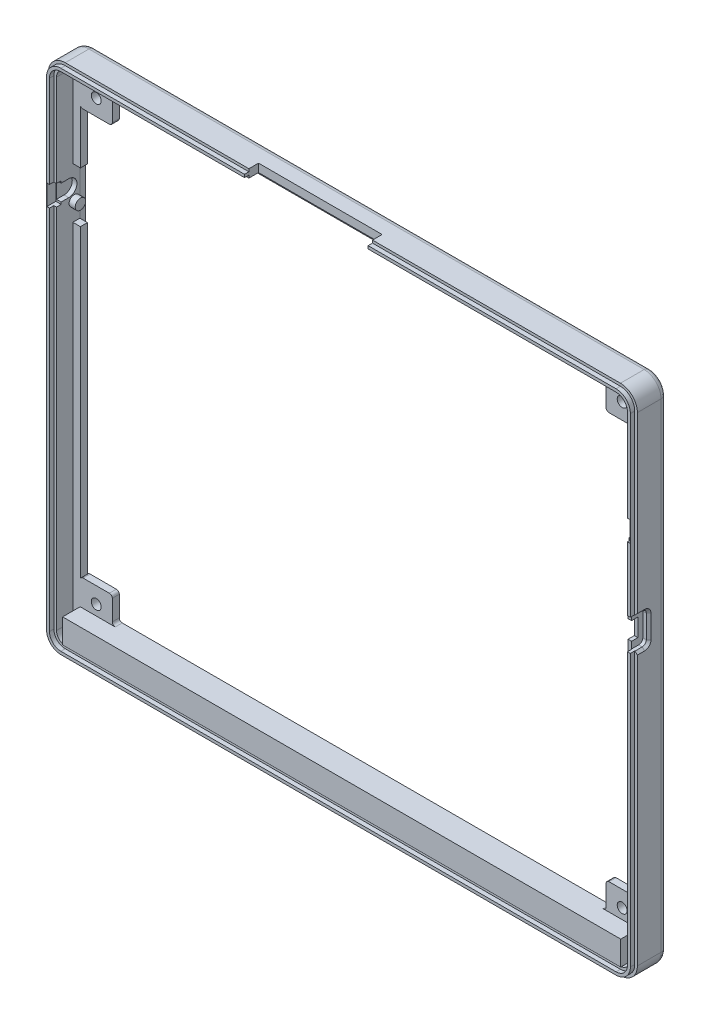
from build123d import *

# Parameters (mm, degrees)
PERIMETER_SHELL_START                = -7.6
PERIMETER_SHELL_DEPTH                = 5.6
OPEN_BACK_FRAME_START                = -12.1
OPEN_BACK_FRAME_DEPTH                = 4.5
PCB_MOUNT_WEB_0_START                = -12.1
PCB_MOUNT_WEB_0_DEPTH                = 4.5
PCB_M3_THROUGH_0_START               = -7.5
PCB_M3_THROUGH_0_PROFILE_R           = 1.7
PCB_M3_THROUGH_0_DEPTH               = 4.7
PCB_MOUNT_WEB_1_START                = -12.1
PCB_MOUNT_WEB_1_DEPTH                = 4.5
PCB_M3_THROUGH_1_START               = -7.5
PCB_M3_THROUGH_1_PROFILE_R           = 1.7
PCB_M3_THROUGH_1_DEPTH               = 4.7
PCB_MOUNT_WEB_2_START                = -12.1
PCB_MOUNT_WEB_2_DEPTH                = 4.5
PCB_M3_THROUGH_2_START               = -7.5
PCB_M3_THROUGH_2_PROFILE_R           = 1.7
PCB_M3_THROUGH_2_DEPTH               = 4.7
PCB_MOUNT_WEB_3_START                = -12.1
PCB_MOUNT_WEB_3_DEPTH                = 4.5
PCB_M3_THROUGH_3_START               = -7.5
PCB_M3_THROUGH_3_PROFILE_R           = 1.7
PCB_M3_THROUGH_3_DEPTH               = 4.7
REAR_GLASS_SEAT_START                = -10
REAR_GLASS_SEAT_DEPTH                = 2.2
PCB_LOWER_EDGE_WEB_START             = -10
PCB_LOWER_EDGE_WEB_PROFILE_W         = 191
PCB_LOWER_EDGE_WEB_PROFILE_H         = 8.3
PCB_LOWER_EDGE_WEB_DEPTH             = 8.4
PCB_SUPPORT_ROOT_ROUND_R             = 1
LOCATING_TONGUE_START                = -2
LOCATING_TONGUE_DEPTH                = 1.5
TOP_CONNECTOR_ACCESS_START           = 14.29999894
TOP_CONNECTOR_ACCESS_PROFILE_W       = 42.3
TOP_CONNECTOR_ACCESS_PROFILE_H       = 13.3
TOP_CONNECTOR_ACCESS_DEPTH           = 19.6
POWER_RETAINING_WEB_START            = -5.85
POWER_RETAINING_WEB_PROFILE_W        = 0.6
POWER_RETAINING_WEB_PROFILE_H        = 13.5
POWER_RETAINING_WEB_DEPTH            = 3.85
SLIDER_SLOT_START                    = -0.35
SLIDER_SLOT_PROFILE_W                = 7.8
SLIDER_SLOT_PROFILE_H                = 6.1
SLIDER_SLOT_DEPTH                    = 3.8
POWER_THUMB_RECESS_START             = 193.8
POWER_THUMB_RECESS_DEPTH             = 3.4
INTERNAL_HINGE_CLEARANCE_0_START     = -1.9
INTERNAL_HINGE_CLEARANCE_0_PROFILE_W = 7.2
INTERNAL_HINGE_CLEARANCE_0_PROFILE_H = 17.4
INTERNAL_HINGE_CLEARANCE_0_DEPTH     = 10.3
INTERNAL_STOP_PIN_0_START            = -3.5
INTERNAL_STOP_PIN_0_PROFILE_R        = 1.8
INTERNAL_STOP_PIN_0_DEPTH            = 2.6
BLIND_AXLE_BEARING_0_START           = -4.6
BLIND_AXLE_BEARING_0_PROFILE_R       = 2.8
BLIND_AXLE_BEARING_0_DEPTH           = 1.7
AXLE_ASSEMBLY_ENTRY_0_START          = -4.6
AXLE_ASSEMBLY_ENTRY_0_PROFILE_W      = 6.3
AXLE_ASSEMBLY_ENTRY_0_PROFILE_H      = 5.6
AXLE_ASSEMBLY_ENTRY_0_DEPTH          = 1.7
KEEPER_SEAT_0_START                  = 0.1
KEEPER_SEAT_0_PROFILE_W              = 2.1
KEEPER_SEAT_0_PROFILE_H              = 7
KEEPER_SEAT_0_DEPTH                  = 3.7
INTERNAL_HINGE_CLEARANCE_1_START     = -1.9
INTERNAL_HINGE_CLEARANCE_1_PROFILE_W = 7.2
INTERNAL_HINGE_CLEARANCE_1_PROFILE_H = 17.4
INTERNAL_HINGE_CLEARANCE_1_DEPTH     = 10.3
INTERNAL_STOP_PIN_1_START            = 190.9
INTERNAL_STOP_PIN_1_PROFILE_R        = 1.8
INTERNAL_STOP_PIN_1_DEPTH            = 2.6
BLIND_AXLE_BEARING_1_START           = 192.9
BLIND_AXLE_BEARING_1_PROFILE_R       = 2.8
BLIND_AXLE_BEARING_1_DEPTH           = 1.7
AXLE_ASSEMBLY_ENTRY_1_START          = 192.9
AXLE_ASSEMBLY_ENTRY_1_PROFILE_W      = 6.3
AXLE_ASSEMBLY_ENTRY_1_PROFILE_H      = 5.6
AXLE_ASSEMBLY_ENTRY_1_DEPTH          = 1.7
KEEPER_SEAT_1_START                  = 0.1
KEEPER_SEAT_1_PROFILE_W              = 2.1
KEEPER_SEAT_1_PROFILE_H              = 7
KEEPER_SEAT_1_DEPTH                  = 3.7
OUTER_REAR_ROUND_R                   = 2


with BuildPart() as part:
    # Perimeter_shell_profile → Perimeter_shell (new body)
    with BuildSketch(Plane.XY.offset(PERIMETER_SHELL_START)):
        with BuildLine():
            Line((0, -9.8), (190, -9.8))
            ThreePointArc((190, -9.8), (194.101219331, -8.101219331), (195.8, -4))
            Line((195.8, -4), (195.8, 160))
            ThreePointArc((195.8, 160), (194.101219331, 164.101219331), (190, 165.8))
            Line((190, 165.8), (0, 165.8))
            ThreePointArc((0, 165.8), (-4.101219331, 164.101219331), (-5.8, 160))
            Line((-5.8, 160), (-5.8, -4))
            ThreePointArc((-5.8, -4), (-4.101219331, -8.101219331), (0, -9.8))
        make_face()
        with BuildLine():
            Line((0, -7), (190, -7))
            ThreePointArc((190, -7), (192.121320344, -6.121320344), (193, -4))
            Line((193, -4), (193, 160))
            ThreePointArc((193, 160), (192.121320344, 162.121320344), (190, 163))
            Line((190, 163), (0, 163))
            ThreePointArc((0, 163), (-2.121320344, 162.121320344), (-3, 160))
            Line((-3, 160), (-3, -4))
            ThreePointArc((-3, -4), (-2.121320344, -6.121320344), (0, -7))
        make_face(mode=Mode.SUBTRACT)
    extrude(amount=PERIMETER_SHELL_DEPTH)

    # Open_back_frame_profile → Open_back_frame (add)
    with BuildSketch(Plane.XY.offset(OPEN_BACK_FRAME_START)):
        with BuildLine():
            Line((0, -9.8), (190, -9.8))
            ThreePointArc((190, -9.8), (194.101219331, -8.101219331), (195.8, -4))
            Line((195.8, -4), (195.8, 160))
            ThreePointArc((195.8, 160), (194.101219331, 164.101219331), (190, 165.8))
            Line((190, 165.8), (0, 165.8))
            ThreePointArc((0, 165.8), (-4.101219331, 164.101219331), (-5.8, 160))
            Line((-5.8, 160), (-5.8, -4))
            ThreePointArc((-5.8, -4), (-4.101219331, -8.101219331), (0, -9.8))
        make_face()
        with BuildLine():
            Line((1.6, -4.4), (188.4, -4.4))
            ThreePointArc((188.4, -4.4), (189.814213562, -3.814213562), (190.4, -2.4))
            Line((190.4, -2.4), (190.4, 158.4))
            ThreePointArc((190.4, 158.4), (189.814213562, 159.814213562), (188.4, 160.4))
            Line((188.4, 160.4), (1.6, 160.4))
            ThreePointArc((1.6, 160.4), (0.185786438, 159.814213562), (-0.4, 158.4))
            Line((-0.4, 158.4), (-0.4, -2.4))
            ThreePointArc((-0.4, -2.4), (0.185786438, -3.814213562), (1.6, -4.4))
        make_face(mode=Mode.SUBTRACT)
    extrude(amount=OPEN_BACK_FRAME_DEPTH)

    # PCB_mount_web_0_profile → PCB_mount_web_0 (add)
    with BuildSketch(Plane.XY.offset(PCB_MOUNT_WEB_0_START)):
        with BuildLine():
            Line((0.5, -6), (9.5, -6))
            ThreePointArc((9.5, -6), (10.207106781, -5.707106781), (10.5, -5))
            Line((10.5, -5), (10.5, 9.5))
            ThreePointArc((10.5, 9.5), (10.207106781, 10.207106781), (9.5, 10.5))
            Line((9.5, 10.5), (0.5, 10.5))
            ThreePointArc((0.5, 10.5), (-0.207106781, 10.207106781), (-0.5, 9.5))
            Line((-0.5, 9.5), (-0.5, -5))
            ThreePointArc((-0.5, -5), (-0.207106781, -5.707106781), (0.5, -6))
        make_face()
    extrude(amount=PCB_MOUNT_WEB_0_DEPTH)

    # PCB_M3_through_0_profile → PCB_M3_through_0 (cut)
    with BuildSketch(Plane.XY.offset(PCB_M3_THROUGH_0_START)):
        with Locations((5, 5)):
            Circle(PCB_M3_THROUGH_0_PROFILE_R)
    extrude(amount=-PCB_M3_THROUGH_0_DEPTH, mode=Mode.SUBTRACT)

    # PCB_mount_web_1_profile → PCB_mount_web_1 (add)
    with BuildSketch(Plane.XY.offset(PCB_MOUNT_WEB_1_START)):
        with BuildLine():
            Line((180.5, -6), (189.5, -6))
            ThreePointArc((189.5, -6), (190.207106781, -5.707106781), (190.5, -5))
            Line((190.5, -5), (190.5, 9.5))
            ThreePointArc((190.5, 9.5), (190.207106781, 10.207106781), (189.5, 10.5))
            Line((189.5, 10.5), (180.5, 10.5))
            ThreePointArc((180.5, 10.5), (179.792893219, 10.207106781), (179.5, 9.5))
            Line((179.5, 9.5), (179.5, -5))
            ThreePointArc((179.5, -5), (179.792893219, -5.707106781), (180.5, -6))
        make_face()
    extrude(amount=PCB_MOUNT_WEB_1_DEPTH)

    # PCB_M3_through_1_profile → PCB_M3_through_1 (cut)
    with BuildSketch(Plane.XY.offset(PCB_M3_THROUGH_1_START)):
        with Locations((185, 5)):
            Circle(PCB_M3_THROUGH_1_PROFILE_R)
    extrude(amount=-PCB_M3_THROUGH_1_DEPTH, mode=Mode.SUBTRACT)

    # PCB_mount_web_2_profile → PCB_mount_web_2 (add)
    with BuildSketch(Plane.XY.offset(PCB_MOUNT_WEB_2_START)):
        with BuildLine():
            Line((0.5, 149.5), (9.5, 149.5))
            ThreePointArc((9.5, 149.5), (10.207106781, 149.792893219), (10.5, 150.5))
            Line((10.5, 150.5), (10.5, 161))
            ThreePointArc((10.5, 161), (10.207106781, 161.707106781), (9.5, 162))
            Line((9.5, 162), (0.5, 162))
            ThreePointArc((0.5, 162), (-0.207106781, 161.707106781), (-0.5, 161))
            Line((-0.5, 161), (-0.5, 150.5))
            ThreePointArc((-0.5, 150.5), (-0.207106781, 149.792893219), (0.5, 149.5))
        make_face()
    extrude(amount=PCB_MOUNT_WEB_2_DEPTH)

    # PCB_M3_through_2_profile → PCB_M3_through_2 (cut)
    with BuildSketch(Plane.XY.offset(PCB_M3_THROUGH_2_START)):
        with Locations((5, 155)):
            Circle(PCB_M3_THROUGH_2_PROFILE_R)
    extrude(amount=-PCB_M3_THROUGH_2_DEPTH, mode=Mode.SUBTRACT)

    # PCB_mount_web_3_profile → PCB_mount_web_3 (add)
    with BuildSketch(Plane.XY.offset(PCB_MOUNT_WEB_3_START)):
        with BuildLine():
            Line((180.5, 149.5), (189.5, 149.5))
            ThreePointArc((189.5, 149.5), (190.207106781, 149.792893219), (190.5, 150.5))
            Line((190.5, 150.5), (190.5, 161))
            ThreePointArc((190.5, 161), (190.207106781, 161.707106781), (189.5, 162))
            Line((189.5, 162), (180.5, 162))
            ThreePointArc((180.5, 162), (179.792893219, 161.707106781), (179.5, 161))
            Line((179.5, 161), (179.5, 150.5))
            ThreePointArc((179.5, 150.5), (179.792893219, 149.792893219), (180.5, 149.5))
        make_face()
    extrude(amount=PCB_MOUNT_WEB_3_DEPTH)

    # PCB_M3_through_3_profile → PCB_M3_through_3 (cut)
    with BuildSketch(Plane.XY.offset(PCB_M3_THROUGH_3_START)):
        with Locations((185, 155)):
            Circle(PCB_M3_THROUGH_3_PROFILE_R)
    extrude(amount=-PCB_M3_THROUGH_3_DEPTH, mode=Mode.SUBTRACT)

    # Rear_glass_seat_profile → Rear_glass_seat (cut)
    with BuildSketch(Plane.XY.offset(REAR_GLASS_SEAT_START)):
        with BuildLine():
            Line((0, -7.25), (190, -7.25))
            ThreePointArc((190, -7.25), (192.298097039, -6.298097039), (193.25, -4))
            Line((193.25, -4), (193.25, 160))
            ThreePointArc((193.25, 160), (192.298097039, 162.298097039), (190, 163.25))
            Line((190, 163.25), (0, 163.25))
            ThreePointArc((0, 163.25), (-2.298097039, 162.298097039), (-3.25, 160))
            Line((-3.25, 160), (-3.25, -4))
            ThreePointArc((-3.25, -4), (-2.298097039, -6.298097039), (0, -7.25))
        make_face()
    extrude(amount=-REAR_GLASS_SEAT_DEPTH, mode=Mode.SUBTRACT)

    # PCB_lower_edge_web_profile → PCB_lower_edge_web (add)
    with BuildSketch(Plane.XY.offset(PCB_LOWER_EDGE_WEB_START)):
        with Locations((95, -2.65)):
            Rectangle(PCB_LOWER_EDGE_WEB_PROFILE_W, PCB_LOWER_EDGE_WEB_PROFILE_H)
    extrude(amount=PCB_LOWER_EDGE_WEB_DEPTH)

    # PCB_support_root_round
    pcb_support_root_round_edges = [part.edges().sort_by_distance(p)[0] for p in [
        (179.5, 1.5, -8.8),
        (10.5, 1.5, -8.8),
    ]]
    fillet(pcb_support_root_round_edges, radius=PCB_SUPPORT_ROOT_ROUND_R)

    # Locating_tongue_profile → Locating_tongue (add)
    with BuildSketch(Plane.XY.offset(LOCATING_TONGUE_START)):
        with BuildLine():
            Line((0, -8.9), (190, -8.9))
            ThreePointArc((190, -8.9), (193.464823228, -7.464823228), (194.9, -4))
            Line((194.9, -4), (194.9, 160))
            ThreePointArc((194.9, 160), (193.464823228, 163.464823228), (190, 164.9))
            Line((190, 164.9), (0, 164.9))
            ThreePointArc((0, 164.9), (-3.464823228, 163.464823228), (-4.9, 160))
            Line((-4.9, 160), (-4.9, -4))
            ThreePointArc((-4.9, -4), (-3.464823228, -7.464823228), (0, -8.9))
        make_face()
        with BuildLine():
            Line((0, -7.9), (190, -7.9))
            ThreePointArc((190, -7.9), (192.757716447, -6.757716447), (193.9, -4))
            Line((193.9, -4), (193.9, 160))
            ThreePointArc((193.9, 160), (192.757716447, 162.757716447), (190, 163.9))
            Line((190, 163.9), (0, 163.9))
            ThreePointArc((0, 163.9), (-2.757716447, 162.757716447), (-3.9, 160))
            Line((-3.9, 160), (-3.9, -4))
            ThreePointArc((-3.9, -4), (-2.757716447, -6.757716447), (0, -7.9))
        make_face(mode=Mode.SUBTRACT)
    extrude(amount=LOCATING_TONGUE_DEPTH)

    # Top_connector_access_profile → Top_connector_access (cut)
    with BuildSketch(Plane.XY.offset(TOP_CONNECTOR_ACCESS_START)):
        with Locations((84.0000633, 160.15)):
            Rectangle(TOP_CONNECTOR_ACCESS_PROFILE_W, TOP_CONNECTOR_ACCESS_PROFILE_H)
    extrude(amount=-TOP_CONNECTOR_ACCESS_DEPTH, mode=Mode.SUBTRACT)

    # Power_retaining_web_profile → Power_retaining_web (add)
    with BuildSketch(Plane.XY.offset(POWER_RETAINING_WEB_START)):
        with Locations((192.9, 94.25)):
            Rectangle(POWER_RETAINING_WEB_PROFILE_W, POWER_RETAINING_WEB_PROFILE_H)
    extrude(amount=POWER_RETAINING_WEB_DEPTH)

    # Slider_slot_profile → Slider_slot (cut)
    with BuildSketch(Plane.XY.offset(SLIDER_SLOT_START)):
        with Locations((193.1, 94.27)):
            Rectangle(SLIDER_SLOT_PROFILE_W, SLIDER_SLOT_PROFILE_H)
    extrude(amount=-SLIDER_SLOT_DEPTH, mode=Mode.SUBTRACT)

    # Power_thumb_recess_profile → Power_thumb_recess (cut)
    with BuildSketch(Plane(origin=(0, 0, 0), x_dir=(0, 0, -1), z_dir=(1, 0, 0)).offset(POWER_THUMB_RECESS_START)):
        with BuildLine():
            Line((5.85, 90.32), (5.85, 98.22))
            ThreePointArc((5.85, 98.22), (5.439949494, 99.209949494), (4.45, 99.62))
            Line((4.45, 99.62), (0.05, 99.62))
            ThreePointArc((0.05, 99.62), (-0.939949494, 99.209949494), (-1.35, 98.22))
            Line((-1.35, 98.22), (-1.35, 90.32))
            ThreePointArc((-1.35, 90.32), (-0.939949494, 89.330050506), (0.05, 88.92))
            Line((0.05, 88.92), (4.45, 88.92))
            ThreePointArc((4.45, 88.92), (5.439949494, 89.330050506), (5.85, 90.32))
        make_face()
    extrude(amount=POWER_THUMB_RECESS_DEPTH, mode=Mode.SUBTRACT)

    # Power_recess_bevel_secti for Power_reces → Power_recess_bevel section 0
    with BuildSketch(Plane(origin=(195, 0, 0), x_dir=(0, 0, -1), z_dir=(1, 0, 0))):
        with BuildLine():
            Line((5.85, 90.32), (5.85, 98.22))
            # circular arc as an exact rational Bezier (weights 1, cos(half-angle), 1)
            Bezier((5.85, 98.22), (5.85, 99.62), (4.45, 99.62), weights=[1, 0.707106781, 1])
            Line((4.45, 99.62), (0.05, 99.62))
            Bezier((0.05, 99.62), (-1.35, 99.62), (-1.35, 98.22), weights=[1, 0.707106781, 1])
            Line((-1.35, 98.22), (-1.35, 90.32))
            Bezier((-1.35, 90.32), (-1.35, 88.92), (0.05, 88.92), weights=[1, 0.707106781, 1])
            Line((0.05, 88.92), (4.45, 88.92))
            Bezier((4.45, 88.92), (5.85, 88.92), (5.85, 90.32), weights=[1, 0.707106781, 1])
        make_face()
    # Power_recess_bevel_secti for Power_r 2 → Power_recess_bevel section 1
    with BuildSketch(Plane(origin=(195.8, 0, 0), x_dir=(0, 0, -1), z_dir=(1, 0, 0))):
        with BuildLine():
            Line((6.65, 90.32), (6.65, 98.22))
            Bezier((6.65, 98.22), (6.65, 100.42), (4.45, 100.42), weights=[1, 0.707106781, 1])
            Line((4.45, 100.42), (0.05, 100.42))
            Bezier((0.05, 100.42), (-2.15, 100.42), (-2.15, 98.22), weights=[1, 0.707106781, 1])
            Line((-2.15, 98.22), (-2.15, 90.32))
            Bezier((-2.15, 90.32), (-2.15, 88.12), (0.05, 88.12), weights=[1, 0.707106781, 1])
            Line((0.05, 88.12), (4.45, 88.12))
            Bezier((4.45, 88.12), (6.65, 88.12), (6.65, 90.32), weights=[1, 0.707106781, 1])
        make_face()
    loft(mode=Mode.SUBTRACT)

    # Internal_hinge_clearance_0_profile → Internal_hinge_clearance_0 (cut)
    with BuildSketch(Plane.XY.offset(INTERNAL_HINGE_CLEARANCE_0_START)):
        with Locations((0.6, 122.9)):
            Rectangle(INTERNAL_HINGE_CLEARANCE_0_PROFILE_W, INTERNAL_HINGE_CLEARANCE_0_PROFILE_H)
    extrude(amount=-INTERNAL_HINGE_CLEARANCE_0_DEPTH, mode=Mode.SUBTRACT)

    # Internal_stop_pin_0_profile → Internal_stop_pin_0 (add)
    with BuildSketch(Plane(origin=(0, 0, 0), x_dir=(0, 0, -1), z_dir=(1, 0, 0)).offset(INTERNAL_STOP_PIN_0_START)):
        with Locations((8.113417162, 120.380602337)):
            Circle(INTERNAL_STOP_PIN_0_PROFILE_R)
    extrude(amount=INTERNAL_STOP_PIN_0_DEPTH)

    # Blind_axle_bearing_0_profile → Blind_axle_bearing_0 (cut)
    with BuildSketch(Plane(origin=(0, 0, 0), x_dir=(0, 0, -1), z_dir=(1, 0, 0)).offset(BLIND_AXLE_BEARING_0_START)):
        with Locations((6.2, 125)):
            Circle(BLIND_AXLE_BEARING_0_PROFILE_R)
    extrude(amount=BLIND_AXLE_BEARING_0_DEPTH, mode=Mode.SUBTRACT)

    # Axle_assembly_entry_0_profile → Axle_assembly_entry_0 (cut)
    with BuildSketch(Plane(origin=(0, 0, 0), x_dir=(0, 0, -1), z_dir=(1, 0, 0)).offset(AXLE_ASSEMBLY_ENTRY_0_START)):
        with Locations((3.05, 125)):
            Rectangle(AXLE_ASSEMBLY_ENTRY_0_PROFILE_W, AXLE_ASSEMBLY_ENTRY_0_PROFILE_H)
    extrude(amount=AXLE_ASSEMBLY_ENTRY_0_DEPTH, mode=Mode.SUBTRACT)

    # Keeper_seat_0_profile → Keeper_seat_0 (cut)
    with BuildSketch(Plane.XY.offset(KEEPER_SEAT_0_START)):
        with Locations((-3.75, 125)):
            Rectangle(KEEPER_SEAT_0_PROFILE_W, KEEPER_SEAT_0_PROFILE_H)
    extrude(amount=-KEEPER_SEAT_0_DEPTH, mode=Mode.SUBTRACT)

    # Internal_hinge_clearance_1_profile → Internal_hinge_clearance_1 (cut)
    with BuildSketch(Plane.XY.offset(INTERNAL_HINGE_CLEARANCE_1_START)):
        with Locations((189.4, 122.9)):
            Rectangle(INTERNAL_HINGE_CLEARANCE_1_PROFILE_W, INTERNAL_HINGE_CLEARANCE_1_PROFILE_H)
    extrude(amount=-INTERNAL_HINGE_CLEARANCE_1_DEPTH, mode=Mode.SUBTRACT)

    # Internal_stop_pin_1_profile → Internal_stop_pin_1 (add)
    with BuildSketch(Plane(origin=(0, 0, 0), x_dir=(0, 0, -1), z_dir=(1, 0, 0)).offset(INTERNAL_STOP_PIN_1_START)):
        with Locations((8.113417162, 120.380602337)):
            Circle(INTERNAL_STOP_PIN_1_PROFILE_R)
    extrude(amount=INTERNAL_STOP_PIN_1_DEPTH)

    # Blind_axle_bearing_1_profile → Blind_axle_bearing_1 (cut)
    with BuildSketch(Plane(origin=(0, 0, 0), x_dir=(0, 0, -1), z_dir=(1, 0, 0)).offset(BLIND_AXLE_BEARING_1_START)):
        with Locations((6.2, 125)):
            Circle(BLIND_AXLE_BEARING_1_PROFILE_R)
    extrude(amount=BLIND_AXLE_BEARING_1_DEPTH, mode=Mode.SUBTRACT)

    # Axle_assembly_entry_1_profile → Axle_assembly_entry_1 (cut)
    with BuildSketch(Plane(origin=(0, 0, 0), x_dir=(0, 0, -1), z_dir=(1, 0, 0)).offset(AXLE_ASSEMBLY_ENTRY_1_START)):
        with Locations((3.05, 125)):
            Rectangle(AXLE_ASSEMBLY_ENTRY_1_PROFILE_W, AXLE_ASSEMBLY_ENTRY_1_PROFILE_H)
    extrude(amount=AXLE_ASSEMBLY_ENTRY_1_DEPTH, mode=Mode.SUBTRACT)

    # Keeper_seat_1_profile → Keeper_seat_1 (cut)
    with BuildSketch(Plane.XY.offset(KEEPER_SEAT_1_START)):
        with Locations((193.75, 125)):
            Rectangle(KEEPER_SEAT_1_PROFILE_W, KEEPER_SEAT_1_PROFILE_H)
    extrude(amount=-KEEPER_SEAT_1_DEPTH, mode=Mode.SUBTRACT)

    # Outer_rear_round
    outer_rear_round_edges = [part.edges().sort_by_distance(p)[0] for p in [
        (-4.101219331, -8.101219331, -12.1),
        (95, -9.8, -12.1),
        (194.101219331, -8.101219331, -12.1),
        (195.8, 78, -12.1),
        (194.101219331, 164.101219331, -12.1),
        (95, 165.8, -12.1),
        (-4.101219331, 164.101219331, -12.1),
        (-5.8, 78, -12.1),
    ]]
    fillet(outer_rear_round_edges, radius=OUTER_REAR_ROUND_R)


solid = part.part
